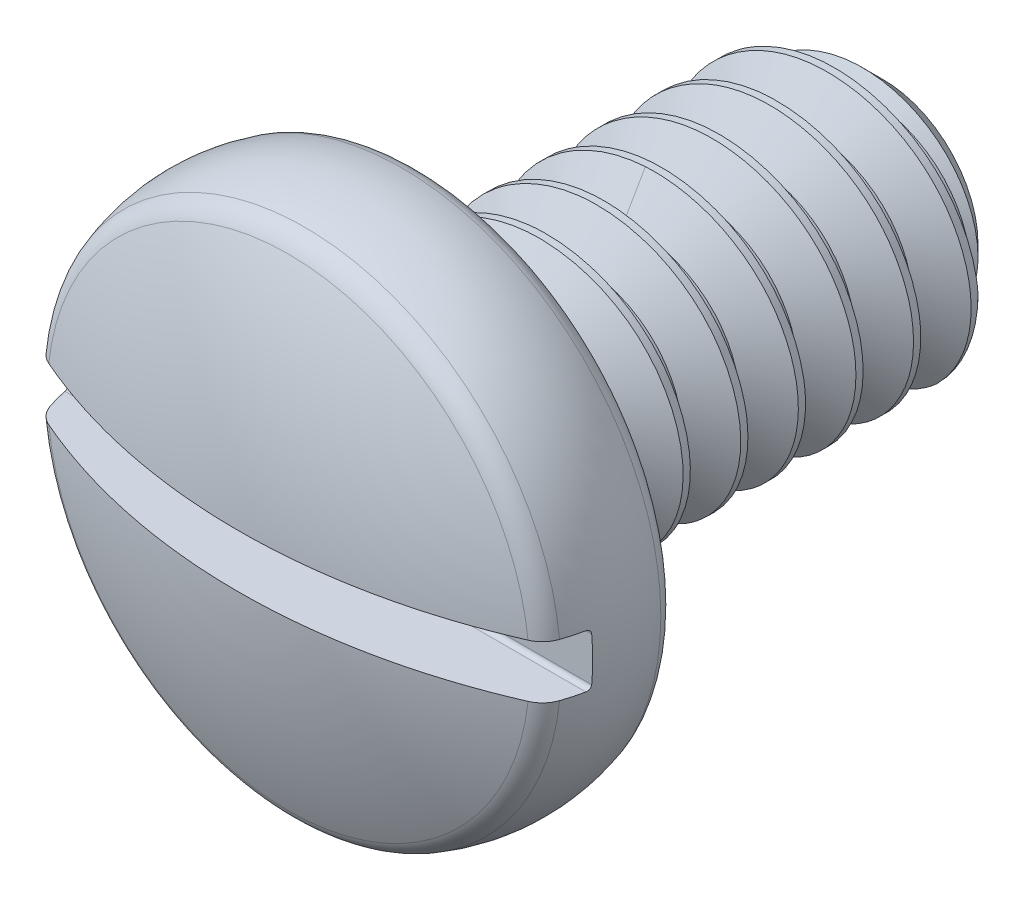
from build123d import *

# Parameters (mm, degrees)
CUT_EXTRUDE1_DEPTH      = 3.145926481
CUT_EXTRUDE1_DEPTH_BACK = 3.145926481
SKETCH9_W               = 0.4
SKETCH9_H               = 0.23
FILLET1_R               = 0.02
FILLET2_R               = 0.12
CHAMFER1_SIZE           = 0.033
CUT_SWEEP1_PITCH        = 0.25
LPATTERN1_COUNT         = 3
LPATTERN1_PITCH         = 0.75


# Read off the part's stored shape, not the designer's step: Split1, Boss-Extrude1
with BuildPart() as part:
    # Sketch2 → Revolve1 (revolve)
    with BuildSketch(Plane(origin=(0, 0, 0), x_dir=(0, 0, -1), z_dir=(1, 0, 0)), mode=Mode.PRIVATE) as revolve1_sk:
        with BuildLine():
            Line((-0.6, 1.0925), (-0.6, 0.612))
            Line((-0.6, 0.612), (-0.5, 0.612))
            Line((-0.5, 0.612), (-0.5, 0.6))
            Line((-0.5, 0.6), (1.2125, 0.6))
            Line((1.2125, 0.6), (1.4, 0.4125))
            Line((1.4, 0.4125), (1.4, 0))
            Line((1.4, 0), (-1.4, 0))
            ThreePointArc((-1.4, 0), (-1.33929307, 0.55927548), (-1.16, 1.0925))
            ThreePointArc((-1.16, 1.0925), (-0.88, 1.15), (-0.6, 1.0925))
        make_face()
    revolve(revolve1_sk.sketch.rotate(Axis((0, 0, 1.4), (0, 0, -1)), 90), axis=Axis((0, 0, 1.4), (0, 0, -1)))

    # Sketch9 → Cut-Extrude1 (cut, two sides: drawn at the far end of the back side and taken through both)
    with BuildSketch(Plane(origin=(0, 0, 0), x_dir=(0, 0, -1), z_dir=(1, 0, 0)).offset(-CUT_EXTRUDE1_DEPTH_BACK)):
        with Locations((-1.2, 0)):
            Rectangle(SKETCH9_W, SKETCH9_H)
    extrude(amount=CUT_EXTRUDE1_DEPTH + CUT_EXTRUDE1_DEPTH_BACK, mode=Mode.SUBTRACT)

    # Fillet1
    fillet1_edges = [part.edges().sort_by_distance(p)[0] for p in [
        (0, 0.115, 1),
        (0, -0.115, 1),
    ]]
    fillet(fillet1_edges, radius=FILLET1_R)

    # Fillet2
    fillet2_edges = [part.edges().sort_by_distance(p)[0] for p in [
        (-1.0925, 0, 0.6),
        (0, -1.0925, 1.16),
        (0, 1.0925, 1.16),
    ]]
    fillet(fillet2_edges, radius=FILLET2_R)

    # Chamfer1
    chamfer1_edges = [part.edges().sort_by_distance(p)[0] for p in [
        (-0.612, 0, 0.6),
    ]]
    chamfer(chamfer1_edges, length=CHAMFER1_SIZE)


with BuildPart() as body_2:
    # Split1: the piece on the far side of the plane
    add(part.part)
    split(bisect_by=Plane.XY.offset(0.5), keep=Keep.BOTTOM)

    # Cut-Sweep1: the profile of Sketch7 profile screwed along a right-hand helix of 5 turns, 6 arcs to a turn; built about Z, then put on its axis
    cut_sweep1_z = Axis((0, 0, 0), (0, 0, 1))
    cut_sweep1_corners = [(0.6003, 0, 0.000173205), (0.6003, 0, -0.218923205), (0.437620237, 0, -0.125), (0.437620237, 0, -0.09375)]
    with BuildLine(mode=Mode.PRIVATE) as cut_sweep1_profile:
        Line(cut_sweep1_corners[0], cut_sweep1_corners[1])
        Line(cut_sweep1_corners[1], cut_sweep1_corners[2])
        Line(cut_sweep1_corners[2], cut_sweep1_corners[3])
        Line(cut_sweep1_corners[3], cut_sweep1_corners[0])
    cut_sweep1_cap = Face(cut_sweep1_profile.wire())
    cut_sweep1_turn_angles = [0, 30, 60, 90, 120, 150, 180, 210, 240, 270, 300, 330, 360]
    cut_sweep1_turn_weights = [1, 0.8660254037844387, 1, 0.8660254037844387, 1, 0.8660254037844387, 1, 0.8660254037844387, 1, 0.8660254037844387, 1, 0.8660254037844387, 1]
    cut_sweep1_turn_rails = [Edge.make_bspline([Vector(p[0], p[1], 0).rotate(cut_sweep1_z, cut_sweep1_turn_angles[k]) / cut_sweep1_turn_weights[k] + Vector(0, 0, p[2] + CUT_SWEEP1_PITCH * cut_sweep1_turn_angles[k] / 360) for k in range(13)], [0, 0, 0, 1, 1, 2, 2, 3, 3, 4, 4, 5, 5, 6, 6, 6], 2, cut_sweep1_turn_weights) for p in cut_sweep1_corners]
    cut_sweep1_turn_sides = [Face.make_surface_from_curves(cut_sweep1_turn_rails[p[0]], cut_sweep1_turn_rails[p[1]]) for p in [(0, 1), (1, 2), (2, 3), (3, 0)]]
    cut_sweep1 = Plane(origin=(0, 0, -1.4), x_dir=(0, 1, 0), z_dir=(0, 0, 1)) * Solid(Shell([*[p.moved(Location((0, 0, CUT_SWEEP1_PITCH * i))) for i in range(5) for p in cut_sweep1_turn_sides], cut_sweep1_cap, cut_sweep1_cap.rotate(cut_sweep1_z, 1800).moved(Location((0, 0, CUT_SWEEP1_PITCH * 1800 / 360)))]))
    add(cut_sweep1, mode=Mode.SUBTRACT)

    # LPattern1: Cut-Sweep1 ×3
    with Locations(*[(0, 0, i * LPATTERN1_PITCH) for i in range(1, LPATTERN1_COUNT)]):
        add(cut_sweep1, mode=Mode.SUBTRACT)


with BuildPart() as part_1:
    add(part.part)

    # Split1
    split(bisect_by=Plane.XY.offset(0.5), keep=Keep.TOP)

    add(body_2.part)  # Boss-Extrude1 merges body 2
    # Boss-Extrude1 outline → Boss-Extrude1 (revolve)
    with BuildSketch(Plane.XZ):
        Polygon((0.43761709, 0.5), (0.43761709, 0.32561709), (0.612, 0.5), align=None)
    revolve(axis=Axis((0, 0, 0), (0, 0, 1)))


solid = part_1.part
